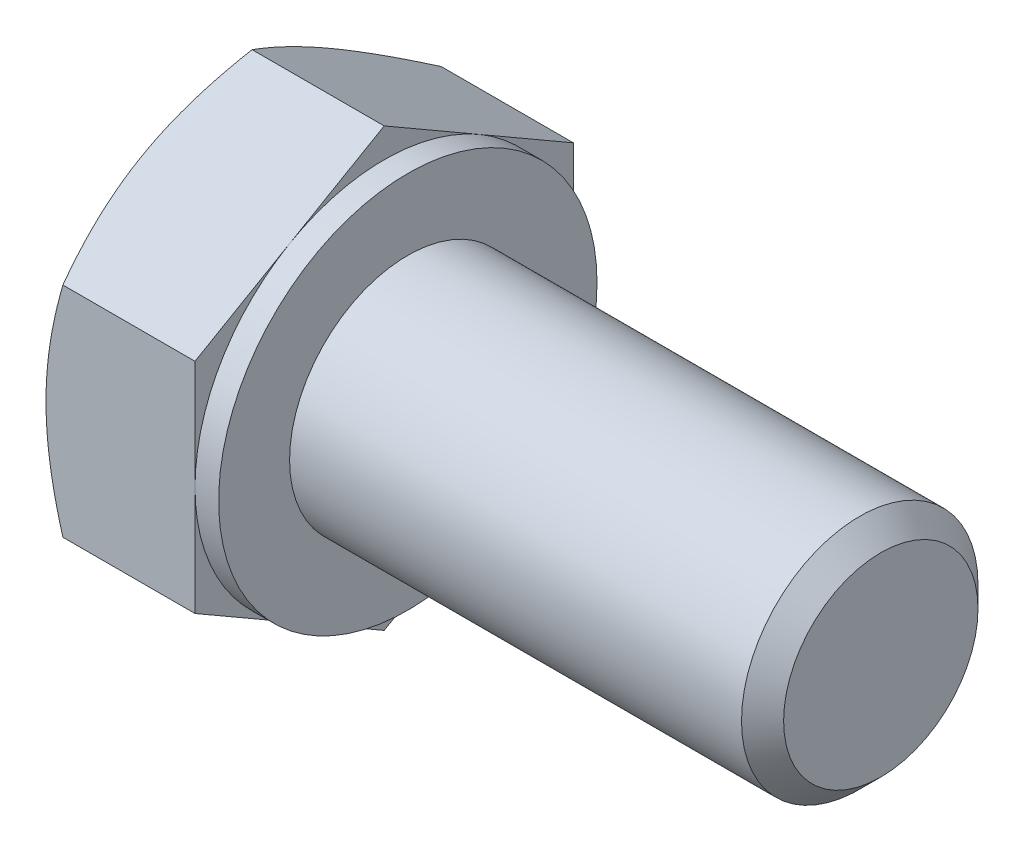
from build123d import *

# Parameters (mm, degrees)
BASEHEAD_DEPTH     = 3.65
INDENT_START       = -0.45625
INDENT_2_OUTLINE_R = 3.5
INDENT_2_DEPTH     = 0.45625
SKETCH4_W          = 0.5
SKETCH4_H          = 10.618802154


# Read off the part's stored shape, not the designer's step: Indent
with BuildPart() as part:
    # Sketch1 → BaseHead (new body)
    with BuildSketch(Plane(origin=(0, 0, 0), x_dir=(0, 0, -1), z_dir=(1, 0, 0))):
        Polygon((4, 2.309401077), (4, -2.309401077), (0, -4.618802154), (-4, -2.309401077), (-4, 2.309401077), (0, 4.618802154), align=None)
    extrude(amount=BASEHEAD_DEPTH)

    # Indent outline → Indent (revolve)
    with BuildSketch(Plane.YX):
        Polygon((2.5, 3.65), (2.5, 13.205), (2.055, 13.65), (0, 13.65), (0, 3.65), align=None)
    revolve(axis=Axis((0, 0, 0), (1, 0, 0)))

    # Indent 2 outline → Indent 2 (cut)
    with BuildSketch(Plane.ZY.offset(INDENT_START)):
        with Locations((0.033212245, 0.192376607)):
            Circle(INDENT_2_OUTLINE_R)
    extrude(amount=INDENT_2_DEPTH, mode=Mode.SUBTRACT)

    # Sketch3 → HeadChamfer (revolve, cut)
    with BuildSketch(Plane.XY, mode=Mode.PRIVATE) as headchamfer_sk:
        Polygon((0, 4), (3.244016936, 9.618802154), (3.244016936, 14.618802154), (-10, 14.618802154), (-10, 4), align=None)
    revolve(headchamfer_sk.sketch.rotate(Axis((0, 0, 0), (1, 0, 0)), 90), axis=Axis((0, 0, 0), (1, 0, 0)), mode=Mode.SUBTRACT)

    # Sketch4 → BearingFace (revolve, cut)
    with BuildSketch(Plane.XY, mode=Mode.PRIVATE) as bearingface_sk:
        with Locations((3.4, 9.309401077)):
            Rectangle(SKETCH4_W, SKETCH4_H)
    revolve(bearingface_sk.sketch.rotate(Axis((0, 0, 0), (1, 0, 0)), 90), axis=Axis((0, 0, 0), (1, 0, 0)), mode=Mode.SUBTRACT)


solid = part.part
